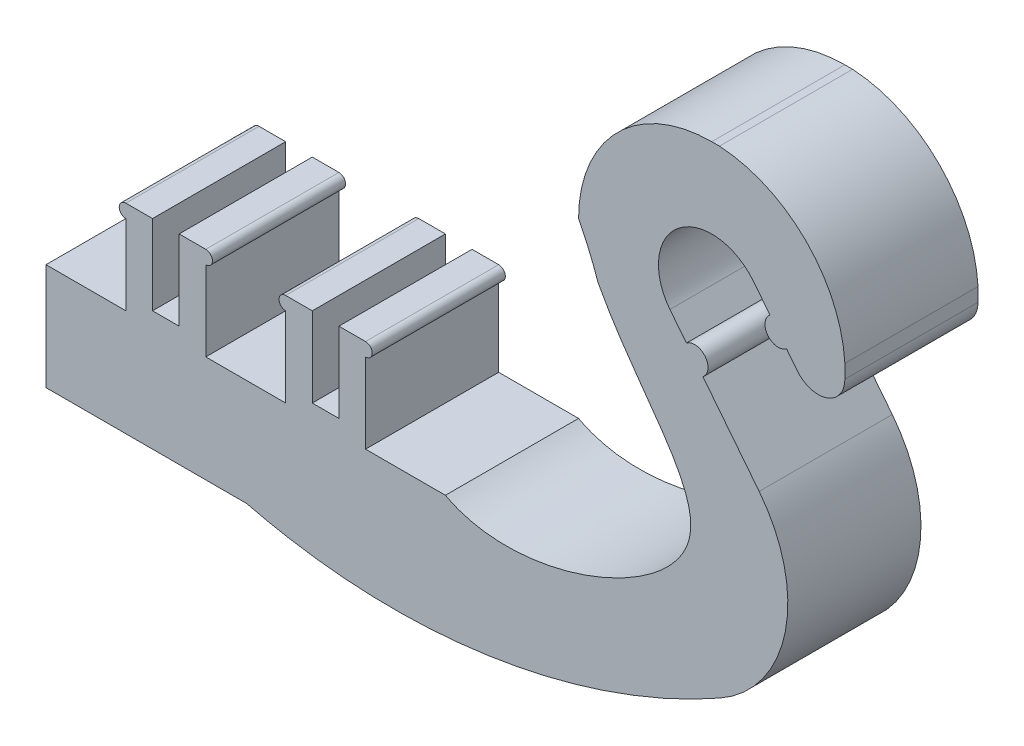
from build123d import *

# Parameters (mm, degrees)
BOSS_EXTRUDE1_DEPTH = 5
BOSS_EXTRUDE2_DEPTH = 5
CUT_EXTRUDE3_START  = -5
CUT_EXTRUDE3_DEPTH  = 5
SKETCH4_W           = 3
SKETCH4_H           = 4
BOSS_EXTRUDE3_DEPTH = 5
SKETCH5_W           = 1
SKETCH5_H           = 3
CUT_EXTRUDE4_DEPTH  = 5


# Read off the part's stored shape, not the designer's step: Cut-Extrude3
with BuildPart() as part:
    # Sketch1 → Boss-Extrude1 (new body)
    with BuildSketch(Plane.XY):
        with BuildLine():
            add(Edge.make_bspline(
                [(-5, 0), (-1.114165851, -7.611100797), (-10, -11.5)],
                knots=[0, 0, 0, 1, 1, 1], degree=2))
            Line((-10, -11.5), (-13, -11.5))
            Line((-13, -11.5), (-13, -8.5))
            Line((-13, -8.5), (-16, -8.5))
            Line((-16, -8.5), (-16, -11.5))
            Line((-16, -11.5), (-19, -11.5))
            Line((-19, -11.5), (-19, -8.5))
            Line((-19, -8.5), (-22, -8.5))
            Line((-22, -8.5), (-22, -15.5))
            Line((-22, -15.5), (-17.468951593, -15.5))
            add(Edge.make_bspline(
                [(-17.468951593, -15.5), (-11.464221473, -17.002032437), (-4.91520191, -15.903447496), (0.325280881, -12.931109156)],
                knots=[0.25236579, 0.25236579, 0.25236579, 0.25236579, 1.015713885, 1.015713885, 1.015713885, 1.015713885], degree=3))
            ThreePointArc((0.325280881, -12.931109156), (2.765522994, -9.541735665), (1.782110459, -5.482729135))
            Line((1.782110459, -5.482729135), (-1.569443242, -1.2396967))
            ThreePointArc((-1.569443242, -1.2396967), (-1.2396967, 1.569443242), (1.569443242, 1.2396967))
            Line((1.569443242, 1.2396967), (3.215278379, -0.843913615))
            ThreePointArc((3.215278379, -0.843913615), (4.328084119, -1.168713777), (5, -0.224065265))
            Line((5, -0.224065265), (5, 0.290683459))
            ThreePointArc((5, 0.290683459), (3.541503697, 3.541503697), (0.290683459, 5))
            Line((0.290683459, 5), (0, 5))
            ThreePointArc((0, 5), (-3.535533906, 3.535533906), (-5, 0))
        make_face()
    extrude(amount=BOSS_EXTRUDE1_DEPTH)

    # Sketch2 → Boss-Extrude2 (add)
    with BuildSketch(Plane.XY.offset(5)):
        with BuildLine():
            Line((2.189291593, 0.454975079), (2.809139943, -0.329746542))
            ThreePointArc((2.809139943, -0.329746542), (2.106854957, -0.247309907), (2.189291593, 0.454975079))
        make_face()
        with BuildLine():
            Line((-0.329746542, -2.809139943), (-0.949594892, -2.024418322))
            ThreePointArc((-0.949594892, -2.024418322), (-0.247309907, -2.106854957), (-0.329746542, -2.809139943))
        make_face()
    extrude(amount=-BOSS_EXTRUDE2_DEPTH)

    # Cut-Extrude3 outline → Cut-Extrude3 (cut)
    with BuildSketch(Plane.XY.offset(5).offset(CUT_EXTRUDE3_START)):
        with BuildLine():
            add(Edge.make_bspline(
                [(-4.271989908, -1.710772943), (-2.750457375, -4.583809325), (2.811238363, -9.068198313), (-7.188128971, -13.02856833), (-10, -11.5)],
                knots=[0.076818774, 0.076818774, 0.076818774, 0.076818774, 0.487236237, 1, 1, 1, 1], degree=3))
            add(Edge.make_bspline(
                [(-4.271989908, -1.710772943), (-2.141880314, -8.060881638), (-10, -11.5)],
                knots=[0.115657624, 0.115657624, 0.115657624, 1, 1, 1], degree=2))
        make_face()
    extrude(amount=CUT_EXTRUDE3_DEPTH, mode=Mode.SUBTRACT)

    # Sketch4 → Boss-Extrude3 (add)
    with BuildSketch(Plane.XY.offset(5)):
        with Locations((-23.5, -13.5)):
            Rectangle(SKETCH4_W, SKETCH4_H)
        with BuildLine():
            Line((-22, -8.5), (-19, -8.5))
            ThreePointArc((-19, -8.5), (-18.75, -8.25), (-19, -8))
            Line((-19, -8), (-22, -8))
            ThreePointArc((-22, -8), (-22.25, -8.25), (-22, -8.5))
        make_face()
        with BuildLine():
            Line((-16, -8.5), (-13, -8.5))
            ThreePointArc((-13, -8.5), (-12.75, -8.25), (-13, -8))
            Line((-13, -8), (-16, -8))
            ThreePointArc((-16, -8), (-16.25, -8.25), (-16, -8.5))
        make_face()
    extrude(amount=-BOSS_EXTRUDE3_DEPTH)

    # Sketch5 → Cut-Extrude4 (cut)
    with BuildSketch(Plane.XY.offset(5)):
        with Locations((-20.5, -9.5)):
            Rectangle(SKETCH5_W, SKETCH5_H)
        with Locations((-14.5, -9.5)):
            Rectangle(SKETCH5_W, SKETCH5_H)
    extrude(amount=-CUT_EXTRUDE4_DEPTH, mode=Mode.SUBTRACT)


solid = part.part
